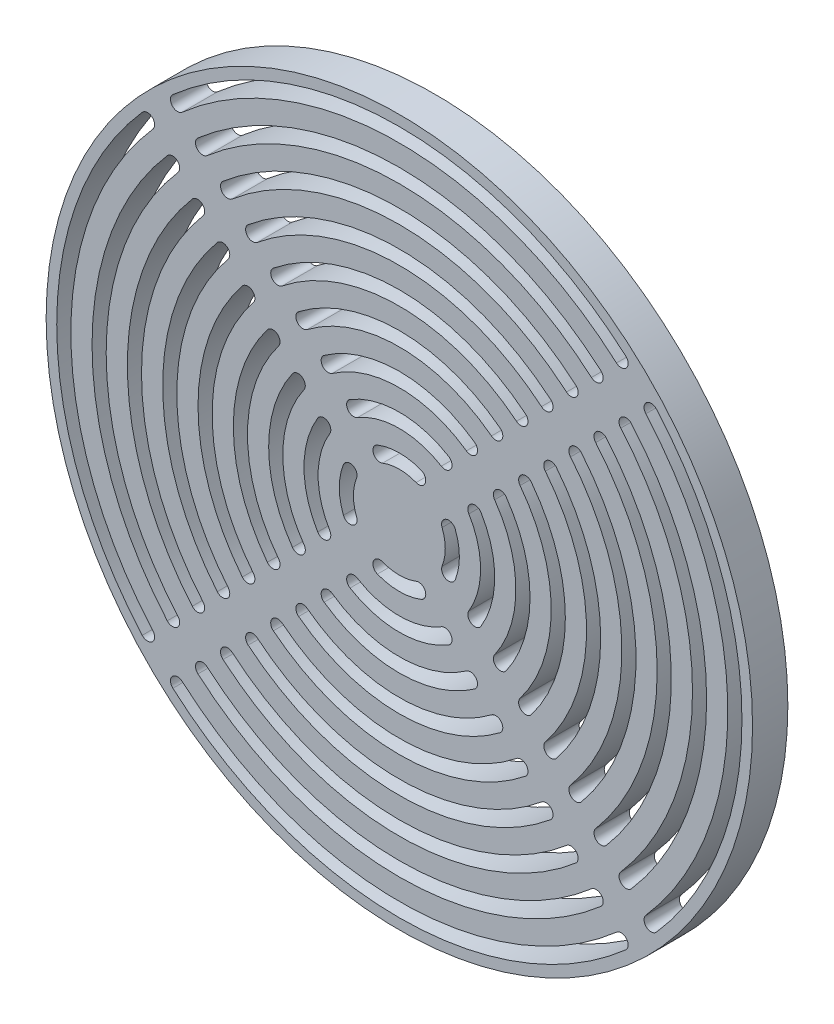
from build123d import *

# Parameters (mm, degrees)
SKETCH_1_R               = 100
EXTRUDE_2_DEPTH          = 10
CUT_EXTRUDE_4_DEPTH      = 10
PATTERN_LINEAR_1_DEPTH   = 10
PATTERN_CIRCULAR_2_COUNT = 4


# Read off the part's stored shape, not the designer's step: 阵列(线性)1
with BuildPart() as part:
    # 草图1 → 凸台-拉伸2 (new body)
    with BuildSketch(Plane.XY):
        Circle(SKETCH_1_R)
    extrude(amount=EXTRUDE_2_DEPTH)

    # 草图2 → 切除-拉伸4 (cut)
    with BuildSketch(Plane.XY.offset(10)):
        with BuildLine():
            ThreePointArc((15.825585299, -6.208933075), (17, 0), (15.825585299, 6.208933075))
            ThreePointArc((15.825585299, 6.208933075), (13.23328902, 7.340303925), (12.10191817, 4.748007646))
            ThreePointArc((12.10191817, 4.748007646), (13, 0), (12.10191817, -4.748007646))
            ThreePointArc((12.10191817, -4.748007646), (13.23328902, -7.340303925), (15.825585299, -6.208933075))
        make_face()
    cut_extrude_4 = extrude(amount=-CUT_EXTRUDE_4_DEPTH, mode=Mode.SUBTRACT)

    # 阵列(线性)1 outline → 阵列(线性)1 (cut)
    with BuildSketch(Plane.XY):
        with BuildLine():
            ThreePointArc((19.69135155, 11.884892685), (23, 0), (19.69135155, -11.884892685))
            ThreePointArc((19.69135155, -11.884892685), (20.370174059, -14.630653054), (23.115934428, -13.951830544))
            ThreePointArc((23.115934428, -13.951830544), (27, 0), (23.115934428, 13.951830544))
            ThreePointArc((23.115934428, 13.951830544), (20.370174059, 14.630653054), (19.69135155, 11.884892685))
        make_face()
        with BuildLine():
            ThreePointArc((62.686277133, 54.400649438), (83, 0), (62.686277133, -54.400649438))
            ThreePointArc((62.686277133, -54.400649438), (62.885930813, -57.222021162), (65.707302537, -57.022367483))
            ThreePointArc((65.707302537, -57.022367483), (87, 0), (65.707302537, 57.022367483))
            ThreePointArc((65.707302537, 57.022367483), (62.885930813, 57.222021162), (62.686277133, 54.400649438))
        make_face()
        with BuildLine():
            ThreePointArc((55.582853347, 47.323846143), (73, 0), (55.582853347, -47.323846143))
            ThreePointArc((55.582853347, -47.323846143), (55.809127517, -50.143207773), (58.628489147, -49.916933603))
            ThreePointArc((58.628489147, -49.916933603), (77, 0), (58.628489147, 49.916933603))
            ThreePointArc((58.628489147, 49.916933603), (55.809127517, 50.143207773), (55.582853347, 47.323846143))
        make_face()
        with BuildLine():
            ThreePointArc((69.782963996, 61.476320124), (93, 0), (69.782963996, -61.476320124))
            ThreePointArc((69.782963996, -61.476320124), (69.961601498, -64.299100428), (72.784381802, -64.120462925))
            ThreePointArc((72.784381802, -64.120462925), (97, 0), (72.784381802, 64.120462925))
            ThreePointArc((72.784381802, 64.120462925), (69.961601498, 64.299100428), (69.782963996, 61.476320124))
        make_face()
        with BuildLine():
            ThreePointArc((34.188186538, 26.080028781), (43, 0), (34.188186538, -26.080028781))
            ThreePointArc((34.188186538, -26.080028781), (34.565310155, -28.883201586), (37.368482961, -28.50607797))
            ThreePointArc((37.368482961, -28.50607797), (47, 0), (37.368482961, 28.50607797))
            ThreePointArc((37.368482961, 28.50607797), (34.565310155, 28.883201586), (34.188186538, 26.080028781))
        make_face()
        with BuildLine():
            ThreePointArc((26.989296432, 18.988888279), (33, 0), (26.989296432, -18.988888279))
            ThreePointArc((26.989296432, -18.988888279), (27.474169653, -21.775444929), (30.260726303, -21.290571707))
            ThreePointArc((30.260726303, -21.290571707), (37, 0), (30.260726303, 21.290571707))
            ThreePointArc((30.260726303, 21.290571707), (27.474169653, 21.775444929), (26.989296432, 18.988888279))
        make_face()
        with BuildLine():
            ThreePointArc((48.469629962, 40.245434168), (63, 0), (48.469629962, -40.245434168))
            ThreePointArc((48.469629962, -40.245434168), (48.730715543, -43.06178541), (51.547066785, -42.80069983))
            ThreePointArc((51.547066785, -42.80069983), (67, 0), (51.547066785, 42.80069983))
            ThreePointArc((51.547066785, 42.80069983), (48.730715543, 43.06178541), (48.469629962, 40.245434168))
        make_face()
        with BuildLine():
            ThreePointArc((41.341353184, 33.164627496), (53, 0), (41.341353184, -33.164627496))
            ThreePointArc((41.341353184, -33.164627496), (41.64990887, -35.976173937), (44.461455311, -35.66761825))
            ThreePointArc((44.461455311, -35.66761825), (57, 0), (44.461455311, 35.66761825))
            ThreePointArc((44.461455311, 35.66761825), (41.64990887, 35.976173937), (41.341353184, 33.164627496))
        make_face()
    pattern_linear_1 = extrude(amount=PATTERN_LINEAR_1_DEPTH, mode=Mode.SUBTRACT)

    # 阵列(圆周)2: 切除-拉伸4, 阵列(线性)1 ×4 about axis
    pattern_circular_2_axis = Axis((0, 0, 0), (0, 0, 1))
    add([cut_extrude_4.rotate(pattern_circular_2_axis, i * 360 / PATTERN_CIRCULAR_2_COUNT) for i in range(1, PATTERN_CIRCULAR_2_COUNT)], mode=Mode.SUBTRACT)
    add([pattern_linear_1.rotate(pattern_circular_2_axis, i * 360 / PATTERN_CIRCULAR_2_COUNT) for i in range(1, PATTERN_CIRCULAR_2_COUNT)], mode=Mode.SUBTRACT)


solid = part.part
